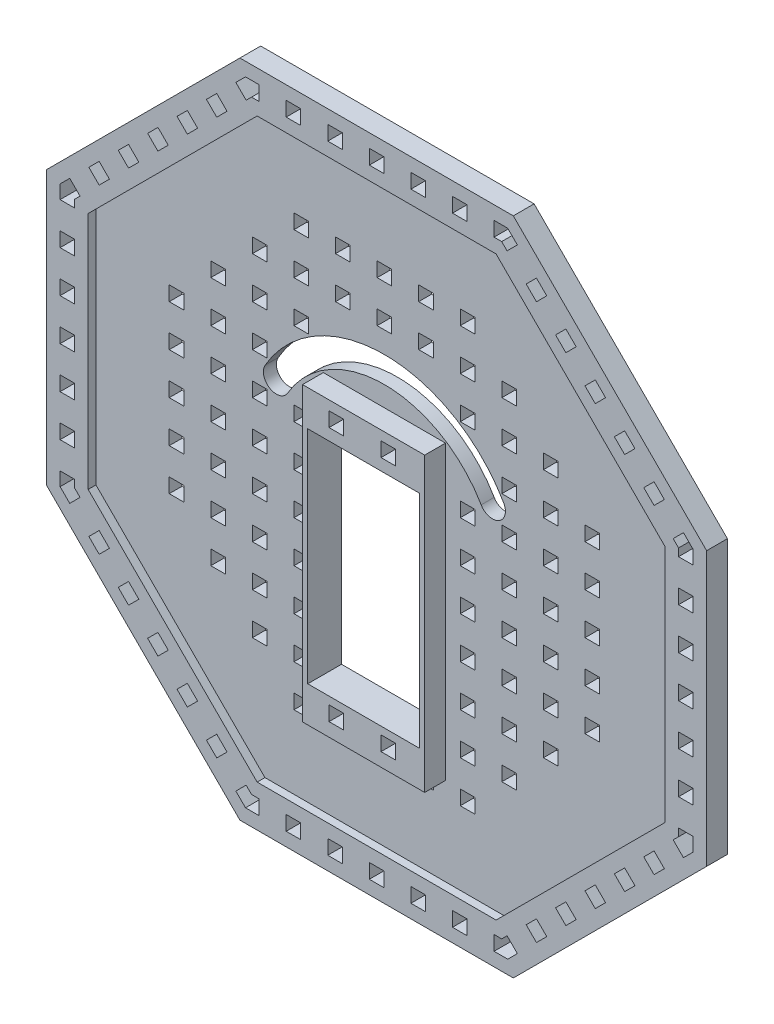
from build123d import *

# Parameters (mm, degrees)
RESSALTO_EXTRUS_O1_DEPTH = 2.5
ESBO_O4_W                = 21.5
ESBO_O4_H                = 42.5
ESBO_O4_W_2              = 2.8
ESBO_O4_H_2              = 2.8
CORTE_EXTRUS_O1_DEPTH    = 5
ESBO_O5_W                = 2.8
ESBO_O5_H                = 2.8
CORTE_EXTRUS_O2_DEPTH    = 90.837353033
ESBO_O7_W                = 2.8
ESBO_O7_H                = 2.8
CORTE_EXTRUS_O3_DEPTH    = 90.837353033
ESBO_O8_R                = 57
ESBO_O8_R_2              = 45
RESSALTO_EXTRUS_O2_DEPTH = 2.5
ESBO_O10_R               = 2.743348867
ESBO_O10_R_2             = 1.931887709
ESBO_O10_R_3             = 2.479399235
RESSALTO_EXTRUS_O3_DEPTH = 2.5
CORTE_EXTRUS_O5_REACH    = 91.837
ESBO_O11_W               = 23.5
ESBO_O11_H               = 56.217797888
ESBO_O11_W_2             = 21.5
ESBO_O11_H_2             = 42.5
ESBO_O11_W_3             = 2.8
ESBO_O11_H_3             = 2.8
RESSALTO_EXTRUS_O4_DEPTH = 4
ESBO_O16_W               = 2.8
ESBO_O16_H               = 2.8
RESSALTO_EXTRUS_O6_DEPTH = 1.5


with BuildPart() as part:
    # Esboço1 → Ressalto-extrusão1 (new body)
    with BuildSketch(Plane.XY):
        Polygon((63.5, -26.302561211), (63.5, 26.302561211), (26.302561211, 63.5), (-26.302561211, 63.5), (-63.5, 26.302561211), (-63.5, -26.302561211), (-26.302561211, -63.5), (26.302561211, -63.5), align=None)
    extrude(amount=RESSALTO_EXTRUS_O1_DEPTH)

    # Esboço4 → Corte-extrusão1 (cut)
    with BuildSketch(Plane(origin=(0, 0, 0), x_dir=(-1, 0, 0), z_dir=(0, 0, -1))):
        with Locations((0, -10.5)):
            Rectangle(ESBO_O4_W, ESBO_O4_H)
        with Locations((-4.75, -34.608898944)):
            Rectangle(ESBO_O4_W_2, ESBO_O4_H_2)
        with Locations((5.25, -34.608898944)):
            Rectangle(ESBO_O4_W_2, ESBO_O4_H_2)
        with Locations((5.25, 14.391101056)):
            Rectangle(ESBO_O4_W_2, ESBO_O4_H_2)
        with Locations((-4.75, 14.391101056)):
            Rectangle(ESBO_O4_W_2, ESBO_O4_H_2)
    extrude(amount=-CORTE_EXTRUS_O1_DEPTH, mode=Mode.SUBTRACT)

    # Esboço5 → Corte-extrusão2 (cut, through all)
    with BuildSketch(Plane.XY):
        Polygon((-47.72970773, -34.436100244), (-49.709606717, -36.415999231), (-47.72970773, -38.395898218), (-45.749808743, -36.415999231), align=None)
        Polygon((-42.072853481, -40.092954493), (-44.052752468, -42.072853481), (-42.072853481, -44.052752468), (-40.092954493, -42.072853481), align=None)
        Polygon((-53.38656198, -28.779245994), (-55.366460967, -30.759144982), (-53.38656198, -32.739043969), (-51.406662992, -30.759144982), align=None)
        Polygon((-60.9, 25.225605949), (-59.043416229, 27.082189719), (-57.063517242, 25.102290732), (-58.1, 24.065807974), (-58.1, 22.6), (-60.9, 22.6), align=None)
        with Locations((-59.5, 8)):
            Rectangle(ESBO_O5_W, ESBO_O5_H)
        with Locations((-59.5, 0)):
            Rectangle(ESBO_O5_W, ESBO_O5_H)
        Polygon((-25.225605949, -60.9), (-27.082189719, -59.043416229), (-25.102290732, -57.063517242), (-24.065807974, -58.1), (-22.6, -58.1), (-22.6, -60.9), align=None)
        Polygon((-30.759144982, -55.366460967), (-32.739043969, -53.38656198), (-30.759144982, -51.406662992), (-28.779245994, -53.38656198), align=None)
        Polygon((-36.415999231, -49.709606717), (-38.395898218, -47.72970773), (-36.415999231, -45.749808743), (-34.436100244, -47.72970773), align=None)
        with Locations((-8, -59.5)):
            Rectangle(ESBO_O5_W, ESBO_O5_H)
        with Locations((0, -59.5)):
            Rectangle(ESBO_O5_W, ESBO_O5_H)
        with Locations((-16, -59.5)):
            Rectangle(ESBO_O5_W, ESBO_O5_H)
        with Locations((-59.5, 16)):
            Rectangle(ESBO_O5_W, ESBO_O5_H)
        with Locations((-16, 8)):
            Rectangle(ESBO_O5_W, ESBO_O5_H)
        Polygon((-58.1, -24.065807974), (-57.063517242, -25.102290732), (-59.043416229, -27.082189719), (-60.9, -25.225605949), (-60.9, -22.6), (-58.1, -22.6), align=None)
        with Locations((-59.5, -16)):
            Rectangle(ESBO_O5_W, ESBO_O5_H)
        with Locations((-59.5, -8)):
            Rectangle(ESBO_O5_W, ESBO_O5_H)
        Polygon((25.225605949, 60.9), (27.082189719, 59.043416229), (25.102290732, 57.063517242), (24.065807974, 58.1), (22.6, 58.1), (22.6, 60.9), align=None)
        Polygon((24.065807974, -58.1), (25.102290732, -57.063517242), (27.082189719, -59.043416229), (25.225605949, -60.9), (22.6, -60.9), (22.6, -58.1), align=None)
        with Locations((8, 59.5)):
            Rectangle(ESBO_O5_W, ESBO_O5_H)
        with Locations((0, 59.5)):
            Rectangle(ESBO_O5_W, ESBO_O5_H)
        with Locations((16, -59.5)):
            Rectangle(ESBO_O5_W, ESBO_O5_H)
        with Locations((8, -59.5)):
            Rectangle(ESBO_O5_W, ESBO_O5_H)
        Polygon((34.436100244, -47.72970773), (36.415999231, -49.709606717), (38.395898218, -47.72970773), (36.415999231, -45.749808743), align=None)
        Polygon((40.092954493, -42.072853481), (42.072853481, -44.052752468), (44.052752468, -42.072853481), (42.072853481, -40.092954493), align=None)
        Polygon((28.779245994, -53.38656198), (30.759144982, -55.366460967), (32.739043969, -53.38656198), (30.759144982, -51.406662992), align=None)
        with Locations((16, 59.5)):
            Rectangle(ESBO_O5_W, ESBO_O5_H)
        Polygon((55.366460967, -30.759144982), (53.38656198, -32.739043969), (51.406662992, -30.759144982), (53.38656198, -28.779245994), align=None)
        Polygon((49.709606717, -36.415999231), (47.72970773, -38.395898218), (45.749808743, -36.415999231), (47.72970773, -34.436100244), align=None)
        Polygon((-24.065807974, 58.1), (-25.102290732, 57.063517242), (-27.082189719, 59.043416229), (-25.225605949, 60.9), (-22.6, 60.9), (-22.6, 58.1), align=None)
        with Locations((-16, 59.5)):
            Rectangle(ESBO_O5_W, ESBO_O5_H)
        with Locations((-8, 59.5)):
            Rectangle(ESBO_O5_W, ESBO_O5_H)
        Polygon((47.72970773, 34.436100244), (49.709606717, 36.415999231), (47.72970773, 38.395898218), (45.749808743, 36.415999231), align=None)
        Polygon((42.072853481, 40.092954493), (44.052752468, 42.072853481), (42.072853481, 44.052752468), (40.092954493, 42.072853481), align=None)
        Polygon((53.38656198, 28.779245994), (55.366460967, 30.759144982), (53.38656198, 32.739043969), (51.406662992, 30.759144982), align=None)
        Polygon((30.759144982, 55.366460967), (32.739043969, 53.38656198), (30.759144982, 51.406662992), (28.779245994, 53.38656198), align=None)
        Polygon((36.415999231, 49.709606717), (38.395898218, 47.72970773), (36.415999231, 45.749808743), (34.436100244, 47.72970773), align=None)
        Polygon((60.9, -25.225605949), (59.043416229, -27.082189719), (57.063517242, -25.102290732), (58.1, -24.065807974), (58.1, -22.6), (60.9, -22.6), align=None)
        with Locations((59.5, -8)):
            Rectangle(ESBO_O5_W, ESBO_O5_H)
        with Locations((59.5, 0)):
            Rectangle(ESBO_O5_W, ESBO_O5_H)
        with Locations((59.5, -16)):
            Rectangle(ESBO_O5_W, ESBO_O5_H)
        Polygon((58.1, 24.065807974), (57.063517242, 25.102290732), (59.043416229, 27.082189719), (60.9, 25.225605949), (60.9, 22.6), (58.1, 22.6), align=None)
        with Locations((59.5, 16)):
            Rectangle(ESBO_O5_W, ESBO_O5_H)
        with Locations((59.5, 8)):
            Rectangle(ESBO_O5_W, ESBO_O5_H)
        Polygon((-34.436100244, 47.72970773), (-36.415999231, 49.709606717), (-38.395898218, 47.72970773), (-36.415999231, 45.749808743), align=None)
        Polygon((-40.092954493, 42.072853481), (-42.072853481, 44.052752468), (-44.052752468, 42.072853481), (-42.072853481, 40.092954493), align=None)
        Polygon((-28.779245994, 53.38656198), (-30.759144982, 55.366460967), (-32.739043969, 53.38656198), (-30.759144982, 51.406662992), align=None)
        Polygon((-55.366460967, 30.759144982), (-53.38656198, 32.739043969), (-51.406662992, 30.759144982), (-53.38656198, 28.779245994), align=None)
        Polygon((-49.709606717, 36.415999231), (-47.72970773, 38.395898218), (-45.749808743, 36.415999231), (-47.72970773, 34.436100244), align=None)
        with Locations((-16, 0)):
            Rectangle(ESBO_O5_W, ESBO_O5_H)
        with Locations((16, 0)):
            Rectangle(ESBO_O5_W, ESBO_O5_H)
        with Locations((24, 0)):
            Rectangle(ESBO_O5_W, ESBO_O5_H)
        with Locations((-16, -8)):
            Rectangle(ESBO_O5_W, ESBO_O5_H)
        with Locations((16, 8)):
            Rectangle(ESBO_O5_W, ESBO_O5_H)
        with Locations((24, 8)):
            Rectangle(ESBO_O5_W, ESBO_O5_H)
        with Locations((24, 16)):
            Rectangle(ESBO_O5_W, ESBO_O5_H)
        with Locations((16, 24)):
            Rectangle(ESBO_O5_W, ESBO_O5_H)
        with Locations((24, 24)):
            Rectangle(ESBO_O5_W, ESBO_O5_H)
        with Locations((8, 32)):
            Rectangle(ESBO_O5_W, ESBO_O5_H)
        with Locations((16, 32)):
            Rectangle(ESBO_O5_W, ESBO_O5_H)
        with Locations((24, 32)):
            Rectangle(ESBO_O5_W, ESBO_O5_H)
        with Locations((32, 32)):
            Rectangle(ESBO_O5_W, ESBO_O5_H)
        with Locations((40, 32)):
            Rectangle(ESBO_O5_W, ESBO_O5_H)
        with Locations((8, 40)):
            Rectangle(ESBO_O5_W, ESBO_O5_H)
        with Locations((16, 40)):
            Rectangle(ESBO_O5_W, ESBO_O5_H)
        with Locations((24, 40)):
            Rectangle(ESBO_O5_W, ESBO_O5_H)
        with Locations((32, 40)):
            Rectangle(ESBO_O5_W, ESBO_O5_H)
        with Locations((8, 48)):
            Rectangle(ESBO_O5_W, ESBO_O5_H)
        with Locations((16, 48)):
            Rectangle(ESBO_O5_W, ESBO_O5_H)
        with Locations((24, 48)):
            Rectangle(ESBO_O5_W, ESBO_O5_H)
        with Locations((0, 24)):
            Rectangle(ESBO_O5_W, ESBO_O5_H)
        with Locations((0, 32)):
            Rectangle(ESBO_O5_W, ESBO_O5_H)
        with Locations((0, 40)):
            Rectangle(ESBO_O5_W, ESBO_O5_H)
        with Locations((0, 48)):
            Rectangle(ESBO_O5_W, ESBO_O5_H)
        with Locations((-24, 48)):
            Rectangle(ESBO_O5_W, ESBO_O5_H)
        with Locations((-16, 48)):
            Rectangle(ESBO_O5_W, ESBO_O5_H)
        with Locations((-8, 48)):
            Rectangle(ESBO_O5_W, ESBO_O5_H)
        with Locations((-32, 40)):
            Rectangle(ESBO_O5_W, ESBO_O5_H)
        with Locations((-24, 40)):
            Rectangle(ESBO_O5_W, ESBO_O5_H)
        with Locations((-16, 40)):
            Rectangle(ESBO_O5_W, ESBO_O5_H)
        with Locations((-8, 40)):
            Rectangle(ESBO_O5_W, ESBO_O5_H)
        with Locations((-40, 32)):
            Rectangle(ESBO_O5_W, ESBO_O5_H)
        with Locations((-32, 32)):
            Rectangle(ESBO_O5_W, ESBO_O5_H)
        with Locations((-24, 32)):
            Rectangle(ESBO_O5_W, ESBO_O5_H)
        with Locations((-16, 32)):
            Rectangle(ESBO_O5_W, ESBO_O5_H)
        with Locations((-8, 32)):
            Rectangle(ESBO_O5_W, ESBO_O5_H)
        with Locations((-24, 24)):
            Rectangle(ESBO_O5_W, ESBO_O5_H)
        with Locations((-16, 24)):
            Rectangle(ESBO_O5_W, ESBO_O5_H)
        with Locations((-24, 16)):
            Rectangle(ESBO_O5_W, ESBO_O5_H)
        with Locations((-24, 8)):
            Rectangle(ESBO_O5_W, ESBO_O5_H)
        with Locations((-24, 0)):
            Rectangle(ESBO_O5_W, ESBO_O5_H)
        with Locations((40, -32)):
            Rectangle(ESBO_O5_W, ESBO_O5_H)
        with Locations((-40, -32)):
            Rectangle(ESBO_O5_W, ESBO_O5_H)
        with Locations((-24, -8)):
            Rectangle(ESBO_O5_W, ESBO_O5_H)
        with Locations((-16, -16)):
            Rectangle(ESBO_O5_W, ESBO_O5_H)
        with Locations((-24, -16)):
            Rectangle(ESBO_O5_W, ESBO_O5_H)
        with Locations((-16, -24)):
            Rectangle(ESBO_O5_W, ESBO_O5_H)
        with Locations((-24, -24)):
            Rectangle(ESBO_O5_W, ESBO_O5_H)
        with Locations((-16, -32)):
            Rectangle(ESBO_O5_W, ESBO_O5_H)
        with Locations((-24, -32)):
            Rectangle(ESBO_O5_W, ESBO_O5_H)
        with Locations((-32, -32)):
            Rectangle(ESBO_O5_W, ESBO_O5_H)
        with Locations((-8, -40)):
            Rectangle(ESBO_O5_W, ESBO_O5_H)
        with Locations((-16, -40)):
            Rectangle(ESBO_O5_W, ESBO_O5_H)
        with Locations((-24, -40)):
            Rectangle(ESBO_O5_W, ESBO_O5_H)
        with Locations((-32, -40)):
            Rectangle(ESBO_O5_W, ESBO_O5_H)
        with Locations((-8, -48)):
            Rectangle(ESBO_O5_W, ESBO_O5_H)
        with Locations((-16, -48)):
            Rectangle(ESBO_O5_W, ESBO_O5_H)
        with Locations((-24, -48)):
            Rectangle(ESBO_O5_W, ESBO_O5_H)
        with Locations((0, -48)):
            Rectangle(ESBO_O5_W, ESBO_O5_H)
        with Locations((0, -40)):
            Rectangle(ESBO_O5_W, ESBO_O5_H)
        with Locations((24, -48)):
            Rectangle(ESBO_O5_W, ESBO_O5_H)
        with Locations((16, -48)):
            Rectangle(ESBO_O5_W, ESBO_O5_H)
        with Locations((8, -48)):
            Rectangle(ESBO_O5_W, ESBO_O5_H)
        with Locations((32, -40)):
            Rectangle(ESBO_O5_W, ESBO_O5_H)
        with Locations((24, -40)):
            Rectangle(ESBO_O5_W, ESBO_O5_H)
        with Locations((16, -40)):
            Rectangle(ESBO_O5_W, ESBO_O5_H)
        with Locations((8, -40)):
            Rectangle(ESBO_O5_W, ESBO_O5_H)
        with Locations((32, -32)):
            Rectangle(ESBO_O5_W, ESBO_O5_H)
        with Locations((24, -32)):
            Rectangle(ESBO_O5_W, ESBO_O5_H)
        with Locations((16, -32)):
            Rectangle(ESBO_O5_W, ESBO_O5_H)
        with Locations((24, -24)):
            Rectangle(ESBO_O5_W, ESBO_O5_H)
        with Locations((16, -24)):
            Rectangle(ESBO_O5_W, ESBO_O5_H)
        with Locations((24, -16)):
            Rectangle(ESBO_O5_W, ESBO_O5_H)
        with Locations((16, -16)):
            Rectangle(ESBO_O5_W, ESBO_O5_H)
        with Locations((24, -8)):
            Rectangle(ESBO_O5_W, ESBO_O5_H)
        with Locations((16, -8)):
            Rectangle(ESBO_O5_W, ESBO_O5_H)
    extrude(amount=CORTE_EXTRUS_O2_DEPTH, mode=Mode.SUBTRACT)

    # Esboço7 → Corte-extrusão3 (cut, through all)
    with BuildSketch(Plane(origin=(0, 0, 0), x_dir=(-1, 0, 0), z_dir=(0, 0, -1))):
        with Locations((-32, 8)):
            Rectangle(ESBO_O7_W, ESBO_O7_H)
        with Locations((40, 24)):
            Rectangle(ESBO_O7_W, ESBO_O7_H)
        with Locations((32, 24)):
            Rectangle(ESBO_O7_W, ESBO_O7_H)
        with Locations((48, 24)):
            Rectangle(ESBO_O7_W, ESBO_O7_H)
        with Locations((40, 16)):
            Rectangle(ESBO_O7_W, ESBO_O7_H)
        with Locations((48, 16)):
            Rectangle(ESBO_O7_W, ESBO_O7_H)
        with Locations((40, 8)):
            Rectangle(ESBO_O7_W, ESBO_O7_H)
        with Locations((48, 8)):
            Rectangle(ESBO_O7_W, ESBO_O7_H)
        with Locations((40, 0)):
            Rectangle(ESBO_O7_W, ESBO_O7_H)
        with Locations((48, 0)):
            Rectangle(ESBO_O7_W, ESBO_O7_H)
        with Locations((40, -8)):
            Rectangle(ESBO_O7_W, ESBO_O7_H)
        with Locations((48, -8)):
            Rectangle(ESBO_O7_W, ESBO_O7_H)
        with Locations((40, -16)):
            Rectangle(ESBO_O7_W, ESBO_O7_H)
        with Locations((48, -16)):
            Rectangle(ESBO_O7_W, ESBO_O7_H)
        with Locations((40, -24)):
            Rectangle(ESBO_O7_W, ESBO_O7_H)
        with Locations((48, -24)):
            Rectangle(ESBO_O7_W, ESBO_O7_H)
        with Locations((32, 16)):
            Rectangle(ESBO_O7_W, ESBO_O7_H)
        with Locations((32, 8)):
            Rectangle(ESBO_O7_W, ESBO_O7_H)
        with Locations((32, 0)):
            Rectangle(ESBO_O7_W, ESBO_O7_H)
        with Locations((32, -8)):
            Rectangle(ESBO_O7_W, ESBO_O7_H)
        with Locations((32, -16)):
            Rectangle(ESBO_O7_W, ESBO_O7_H)
        with Locations((32, -24)):
            Rectangle(ESBO_O7_W, ESBO_O7_H)
        with Locations((-32, 0)):
            Rectangle(ESBO_O7_W, ESBO_O7_H)
        with Locations((-32, -24)):
            Rectangle(ESBO_O7_W, ESBO_O7_H)
        with Locations((-32, -16)):
            Rectangle(ESBO_O7_W, ESBO_O7_H)
        with Locations((-32, -8)):
            Rectangle(ESBO_O7_W, ESBO_O7_H)
        with Locations((-32, 16)):
            Rectangle(ESBO_O7_W, ESBO_O7_H)
        with Locations((-48, -24)):
            Rectangle(ESBO_O7_W, ESBO_O7_H)
        with Locations((-40, -24)):
            Rectangle(ESBO_O7_W, ESBO_O7_H)
        with Locations((-48, -16)):
            Rectangle(ESBO_O7_W, ESBO_O7_H)
        with Locations((-40, -16)):
            Rectangle(ESBO_O7_W, ESBO_O7_H)
        with Locations((-48, -8)):
            Rectangle(ESBO_O7_W, ESBO_O7_H)
        with Locations((-40, -8)):
            Rectangle(ESBO_O7_W, ESBO_O7_H)
        with Locations((-48, 0)):
            Rectangle(ESBO_O7_W, ESBO_O7_H)
        with Locations((-40, 0)):
            Rectangle(ESBO_O7_W, ESBO_O7_H)
        with Locations((-48, 8)):
            Rectangle(ESBO_O7_W, ESBO_O7_H)
        with Locations((-40, 8)):
            Rectangle(ESBO_O7_W, ESBO_O7_H)
        with Locations((-48, 16)):
            Rectangle(ESBO_O7_W, ESBO_O7_H)
        with Locations((-40, 16)):
            Rectangle(ESBO_O7_W, ESBO_O7_H)
        with Locations((-48, 24)):
            Rectangle(ESBO_O7_W, ESBO_O7_H)
        with Locations((-40, 24)):
            Rectangle(ESBO_O7_W, ESBO_O7_H)
        with Locations((-32, 24)):
            Rectangle(ESBO_O7_W, ESBO_O7_H)
    extrude(amount=-CORTE_EXTRUS_O3_DEPTH, mode=Mode.SUBTRACT)

    # Esboço8 → Ressalto-extrusão2 (add, through all)
    with BuildSketch(Plane(origin=(0, 0, 0), x_dir=(-1, 0, 0), z_dir=(0, 0, -1))):
        Circle(ESBO_O8_R)
        Circle(ESBO_O8_R_2, mode=Mode.SUBTRACT)
    extrude(amount=-RESSALTO_EXTRUS_O2_DEPTH)

    # Esboço10 → Ressalto-extrusão3 (add, through all)
    with BuildSketch(Plane.XY.offset(2.5)):
        with Locations((-31.328539187, 31.372499818)):
            Circle(ESBO_O10_R)
        with Locations((-23.130931672, 38.6)):
            Circle(ESBO_O10_R_2)
        with Locations((-38.6, 23.130931672)):
            Circle(ESBO_O10_R_3)
        with Locations((38.6, 23.130931672)):
            Circle(ESBO_O10_R_3)
        with Locations((23.130931672, 38.6)):
            Circle(ESBO_O10_R_2)
        with Locations((31.328539187, 31.372499818)):
            Circle(ESBO_O10_R)
        with Locations((31.328539187, -31.372499818)):
            Circle(ESBO_O10_R)
        with Locations((23.130931672, -38.6)):
            Circle(ESBO_O10_R_2)
        with Locations((38.6, -23.130931672)):
            Circle(ESBO_O10_R_3)
        with Locations((-38.6, -23.130931672)):
            Circle(ESBO_O10_R_3)
        with Locations((-23.130931672, -38.6)):
            Circle(ESBO_O10_R_2)
        with Locations((-31.328539187, -31.372499818)):
            Circle(ESBO_O10_R)
    extrude(amount=-RESSALTO_EXTRUS_O3_DEPTH)

    # Esboço9 → Corte-extrusão5 (cut, up to next)
    with BuildSketch(Plane.XY.offset(2.5), mode=Mode.PRIVATE) as corte_extrus_o5_sk1:
        with BuildLine():
            ThreePointArc((22.94967722, 13.250002321), (0, 26.500004642), (-22.94967722, 13.250002321))
            ThreePointArc((-22.94967722, 13.250002321), (-22.034613711, 9.834938812), (-18.619550202, 10.750002321))
            ThreePointArc((-18.619550202, 10.750002321), (0, 21.500004642), (18.619550202, 10.750002321))
            ThreePointArc((18.619550202, 10.750002321), (22.034613711, 9.834938812), (22.94967722, 13.250002321))
        make_face()
    corte_extrus_o5_tool1 = extrude(corte_extrus_o5_sk1.sketch, amount=-CORTE_EXTRUS_O5_REACH, mode=Mode.PRIVATE) & part.part
    add(corte_extrus_o5_tool1.solids().sort_by_distance((21.786738, 10.264272, 2.5))[0], mode=Mode.SUBTRACT)

    # Esboço11 → Ressalto-extrusão4 (add)
    with BuildSketch(Plane.XY.offset(2.5)):
        with Locations((0, -10.5)):
            Rectangle(ESBO_O11_W, ESBO_O11_H)
        with Locations((0, -10.5)):
            Rectangle(ESBO_O11_W_2, ESBO_O11_H_2, mode=Mode.SUBTRACT)
        with Locations((-5.25, -34.608898944)):
            Rectangle(ESBO_O11_W_3, ESBO_O11_H_3, mode=Mode.SUBTRACT)
        with Locations((4.75, -34.608898944)):
            Rectangle(ESBO_O11_W_3, ESBO_O11_H_3, mode=Mode.SUBTRACT)
        with Locations((-5.25, 14.391101056)):
            Rectangle(ESBO_O11_W_3, ESBO_O11_H_3, mode=Mode.SUBTRACT)
        with Locations((4.75, 14.391101056)):
            Rectangle(ESBO_O11_W_3, ESBO_O11_H_3, mode=Mode.SUBTRACT)
    extrude(amount=RESSALTO_EXTRUS_O4_DEPTH)

    # Esboço16 → Ressalto-extrusão6 (add)
    with BuildSketch(Plane.XY.offset(2.5)):
        Polygon((-26.302561211, -63.5), (26.302561211, -63.5), (63.5, -26.302561211), (63.5, 26.302561211), (26.302561211, 63.5), (-26.302561211, 63.5), (-63.5, 26.302561211), (-63.5, -26.302561211), align=None)
        Polygon((-47.72970773, -34.436100244), (-49.709606717, -36.415999231), (-47.72970773, -38.395898218), (-45.749808743, -36.415999231), align=None, mode=Mode.SUBTRACT)
        Polygon((-42.072853481, -40.092954493), (-44.052752468, -42.072853481), (-42.072853481, -44.052752468), (-40.092954493, -42.072853481), align=None, mode=Mode.SUBTRACT)
        Polygon((-53.38656198, -28.779245994), (-55.366460967, -30.759144982), (-53.38656198, -32.739043969), (-51.406662992, -30.759144982), align=None, mode=Mode.SUBTRACT)
        Polygon((-60.9, 25.225605949), (-59.043416229, 27.082189719), (-57.063517242, 25.102290732), (-58.1, 24.065807974), (-58.1, 22.6), (-60.9, 22.6), align=None, mode=Mode.SUBTRACT)
        with Locations((-59.5, 8)):
            Rectangle(ESBO_O16_W, ESBO_O16_H, mode=Mode.SUBTRACT)
        with Locations((-59.5, 0)):
            Rectangle(ESBO_O16_W, ESBO_O16_H, mode=Mode.SUBTRACT)
        Polygon((-25.225605949, -60.9), (-27.082189719, -59.043416229), (-25.102290732, -57.063517242), (-24.065807974, -58.1), (-22.6, -58.1), (-22.6, -60.9), align=None, mode=Mode.SUBTRACT)
        Polygon((-30.759144982, -55.366460967), (-32.739043969, -53.38656198), (-30.759144982, -51.406662992), (-28.779245994, -53.38656198), align=None, mode=Mode.SUBTRACT)
        Polygon((-36.415999231, -49.709606717), (-38.395898218, -47.72970773), (-36.415999231, -45.749808743), (-34.436100244, -47.72970773), align=None, mode=Mode.SUBTRACT)
        with Locations((-8, -59.5)):
            Rectangle(ESBO_O16_W, ESBO_O16_H, mode=Mode.SUBTRACT)
        with Locations((0, -59.5)):
            Rectangle(ESBO_O16_W, ESBO_O16_H, mode=Mode.SUBTRACT)
        with Locations((-16, -59.5)):
            Rectangle(ESBO_O16_W, ESBO_O16_H, mode=Mode.SUBTRACT)
        with Locations((-59.5, 16)):
            Rectangle(ESBO_O16_W, ESBO_O16_H, mode=Mode.SUBTRACT)
        Polygon((-58.1, -24.065807974), (-57.063517242, -25.102290732), (-59.043416229, -27.082189719), (-60.9, -25.225605949), (-60.9, -22.6), (-58.1, -22.6), align=None, mode=Mode.SUBTRACT)
        with Locations((-59.5, -16)):
            Rectangle(ESBO_O16_W, ESBO_O16_H, mode=Mode.SUBTRACT)
        with Locations((-59.5, -8)):
            Rectangle(ESBO_O16_W, ESBO_O16_H, mode=Mode.SUBTRACT)
        Polygon((25.225605949, 60.9), (27.082189719, 59.043416229), (25.102290732, 57.063517242), (24.065807974, 58.1), (22.6, 58.1), (22.6, 60.9), align=None, mode=Mode.SUBTRACT)
        Polygon((24.065807974, -58.1), (25.102290732, -57.063517242), (27.082189719, -59.043416229), (25.225605949, -60.9), (22.6, -60.9), (22.6, -58.1), align=None, mode=Mode.SUBTRACT)
        with Locations((8, 59.5)):
            Rectangle(ESBO_O16_W, ESBO_O16_H, mode=Mode.SUBTRACT)
        with Locations((0, 59.5)):
            Rectangle(ESBO_O16_W, ESBO_O16_H, mode=Mode.SUBTRACT)
        with Locations((16, -59.5)):
            Rectangle(ESBO_O16_W, ESBO_O16_H, mode=Mode.SUBTRACT)
        with Locations((8, -59.5)):
            Rectangle(ESBO_O16_W, ESBO_O16_H, mode=Mode.SUBTRACT)
        Polygon((34.436100244, -47.72970773), (36.415999231, -49.709606717), (38.395898218, -47.72970773), (36.415999231, -45.749808743), align=None, mode=Mode.SUBTRACT)
        Polygon((40.092954493, -42.072853481), (42.072853481, -44.052752468), (44.052752468, -42.072853481), (42.072853481, -40.092954493), align=None, mode=Mode.SUBTRACT)
        Polygon((28.779245994, -53.38656198), (30.759144982, -55.366460967), (32.739043969, -53.38656198), (30.759144982, -51.406662992), align=None, mode=Mode.SUBTRACT)
        with Locations((16, 59.5)):
            Rectangle(ESBO_O16_W, ESBO_O16_H, mode=Mode.SUBTRACT)
        Polygon((55.366460967, -30.759144982), (53.38656198, -32.739043969), (51.406662992, -30.759144982), (53.38656198, -28.779245994), align=None, mode=Mode.SUBTRACT)
        Polygon((49.709606717, -36.415999231), (47.72970773, -38.395898218), (45.749808743, -36.415999231), (47.72970773, -34.436100244), align=None, mode=Mode.SUBTRACT)
        Polygon((-24.065807974, 58.1), (-25.102290732, 57.063517242), (-27.082189719, 59.043416229), (-25.225605949, 60.9), (-22.6, 60.9), (-22.6, 58.1), align=None, mode=Mode.SUBTRACT)
        with Locations((-16, 59.5)):
            Rectangle(ESBO_O16_W, ESBO_O16_H, mode=Mode.SUBTRACT)
        with Locations((-8, 59.5)):
            Rectangle(ESBO_O16_W, ESBO_O16_H, mode=Mode.SUBTRACT)
        Polygon((47.72970773, 34.436100244), (49.709606717, 36.415999231), (47.72970773, 38.395898218), (45.749808743, 36.415999231), align=None, mode=Mode.SUBTRACT)
        Polygon((42.072853481, 40.092954493), (44.052752468, 42.072853481), (42.072853481, 44.052752468), (40.092954493, 42.072853481), align=None, mode=Mode.SUBTRACT)
        Polygon((53.38656198, 28.779245994), (55.366460967, 30.759144982), (53.38656198, 32.739043969), (51.406662992, 30.759144982), align=None, mode=Mode.SUBTRACT)
        Polygon((30.759144982, 55.366460967), (32.739043969, 53.38656198), (30.759144982, 51.406662992), (28.779245994, 53.38656198), align=None, mode=Mode.SUBTRACT)
        Polygon((36.415999231, 49.709606717), (38.395898218, 47.72970773), (36.415999231, 45.749808743), (34.436100244, 47.72970773), align=None, mode=Mode.SUBTRACT)
        Polygon((60.9, -25.225605949), (59.043416229, -27.082189719), (57.063517242, -25.102290732), (58.1, -24.065807974), (58.1, -22.6), (60.9, -22.6), align=None, mode=Mode.SUBTRACT)
        with Locations((59.5, -8)):
            Rectangle(ESBO_O16_W, ESBO_O16_H, mode=Mode.SUBTRACT)
        with Locations((59.5, 0)):
            Rectangle(ESBO_O16_W, ESBO_O16_H, mode=Mode.SUBTRACT)
        with Locations((59.5, -16)):
            Rectangle(ESBO_O16_W, ESBO_O16_H, mode=Mode.SUBTRACT)
        Polygon((58.1, 24.065807974), (57.063517242, 25.102290732), (59.043416229, 27.082189719), (60.9, 25.225605949), (60.9, 22.6), (58.1, 22.6), align=None, mode=Mode.SUBTRACT)
        with Locations((59.5, 16)):
            Rectangle(ESBO_O16_W, ESBO_O16_H, mode=Mode.SUBTRACT)
        with Locations((59.5, 8)):
            Rectangle(ESBO_O16_W, ESBO_O16_H, mode=Mode.SUBTRACT)
        Polygon((-34.436100244, 47.72970773), (-36.415999231, 49.709606717), (-38.395898218, 47.72970773), (-36.415999231, 45.749808743), align=None, mode=Mode.SUBTRACT)
        Polygon((-40.092954493, 42.072853481), (-42.072853481, 44.052752468), (-44.052752468, 42.072853481), (-42.072853481, 40.092954493), align=None, mode=Mode.SUBTRACT)
        Polygon((-28.779245994, 53.38656198), (-30.759144982, 55.366460967), (-32.739043969, 53.38656198), (-30.759144982, 51.406662992), align=None, mode=Mode.SUBTRACT)
        Polygon((-22.988852712, 55.5), (-55.5, 22.988852712), (-55.5, -22.988852712), (-22.988852712, -55.5), (22.988852712, -55.5), (55.5, -22.988852712), (55.5, 22.988852712), (22.988852712, 55.5), align=None, mode=Mode.SUBTRACT)
        Polygon((-55.366460967, 30.759144982), (-53.38656198, 32.739043969), (-51.406662992, 30.759144982), (-53.38656198, 28.779245994), align=None, mode=Mode.SUBTRACT)
        Polygon((-49.709606717, 36.415999231), (-47.72970773, 38.395898218), (-45.749808743, 36.415999231), (-47.72970773, 34.436100244), align=None, mode=Mode.SUBTRACT)
    extrude(amount=RESSALTO_EXTRUS_O6_DEPTH)


solid = part.part
